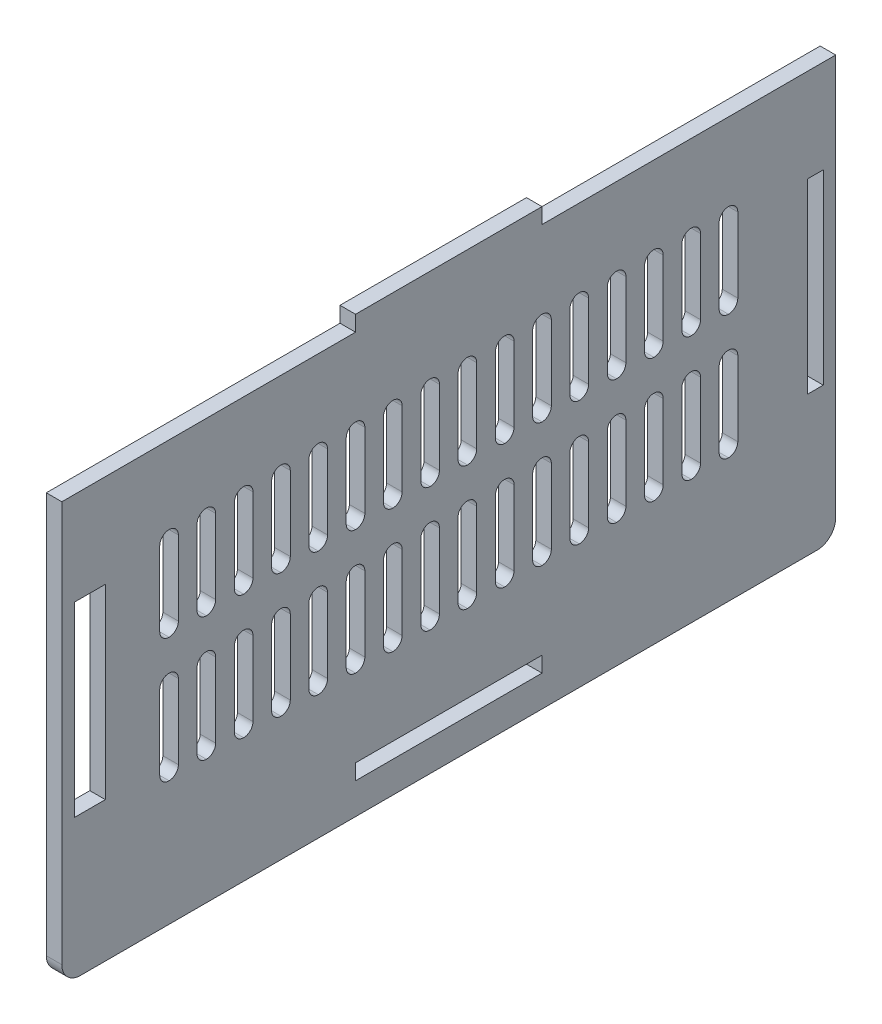
from build123d import *

# Parameters (mm, degrees)
SKETCH1_W           = 2.5
SKETCH1_H           = 30
BOSS_EXTRUDE1_DEPTH = 1.25
FILLET1_R           = 3
SKETCH2_W           = 3
SKETCH2_H           = 15
CUT_EXTRUDE1_DEPTH  = 73.715627619
FILLET2_R           = 1.5


with BuildPart() as part:
    # Sketch1 → Boss-Extrude1 (new, symmetric)
    # profile 1 of 2: a face of its own
    with BuildSketch(Plane(origin=(0, 0, 0), x_dir=(0, 0, -1), z_dir=(1, 0, 0))):
        Polygon((-15, 30), (-62.25, 30), (-62.25, -30), (-15, -30), (15, -30), (62.25, -30), (62.25, 30), (15, 30), (15, 32.5), (-15, 32.5), align=None)
        Polygon((-60.25, 15), (-57.75, 15), (-55.25, 15), (-55.25, -15), (-57.75, -15), (-60.25, -15), align=None, mode=Mode.SUBTRACT)
        with Locations((59, 0)):
            Rectangle(SKETCH1_W, SKETCH1_H, mode=Mode.SUBTRACT)
    # profile 2 of 2: a face of its own
    with BuildSketch(Plane(origin=(0, 0, 0), x_dir=(0, 0, -1), z_dir=(1, 0, 0))):
        Polygon((-15, -30), (-62.25, -30), (-62.25, -37.5), (-15, -37.5), (15, -37.5), (62.25, -37.5), (62.25, -30), (15, -30), (15, -32.5), (-15, -32.5), align=None)
    extrude(amount=BOSS_EXTRUDE1_DEPTH, both=True)

    # Fillet1
    fillet1_edges = [part.edges().sort_by_distance(p)[0] for p in [
        (0, -37.5, 62.25),
        (0, -37.5, -62.25),
    ]]
    fillet(fillet1_edges, radius=FILLET1_R)

    # Sketch2 → Cut-Extrude1 (cut, through all)
    with BuildSketch(Plane(origin=(1.25, 0, 0), x_dir=(0, 0, -1), z_dir=(1, 0, 0))):
        with Locations((-45, 10)):
            Rectangle(SKETCH2_W, SKETCH2_H)
        with Locations((-45, -10)):
            Rectangle(SKETCH2_W, SKETCH2_H)
        with Locations((-39, 10)):
            Rectangle(SKETCH2_W, SKETCH2_H)
        with Locations((-39, -10)):
            Rectangle(SKETCH2_W, SKETCH2_H)
        with Locations((-33, 10)):
            Rectangle(SKETCH2_W, SKETCH2_H)
        with Locations((-33, -10)):
            Rectangle(SKETCH2_W, SKETCH2_H)
        with Locations((-27, 10)):
            Rectangle(SKETCH2_W, SKETCH2_H)
        with Locations((-27, -10)):
            Rectangle(SKETCH2_W, SKETCH2_H)
        with Locations((-21, 10)):
            Rectangle(SKETCH2_W, SKETCH2_H)
        with Locations((-21, -10)):
            Rectangle(SKETCH2_W, SKETCH2_H)
        with Locations((-15, 10)):
            Rectangle(SKETCH2_W, SKETCH2_H)
        with Locations((-15, -10)):
            Rectangle(SKETCH2_W, SKETCH2_H)
        with Locations((-9, 10)):
            Rectangle(SKETCH2_W, SKETCH2_H)
        with Locations((-9, -10)):
            Rectangle(SKETCH2_W, SKETCH2_H)
        with Locations((-3, 10)):
            Rectangle(SKETCH2_W, SKETCH2_H)
        with Locations((-3, -10)):
            Rectangle(SKETCH2_W, SKETCH2_H)
        with Locations((3, -10)):
            Rectangle(SKETCH2_W, SKETCH2_H)
        with Locations((3, 10)):
            Rectangle(SKETCH2_W, SKETCH2_H)
        with Locations((9, -10)):
            Rectangle(SKETCH2_W, SKETCH2_H)
        with Locations((9, 10)):
            Rectangle(SKETCH2_W, SKETCH2_H)
        with Locations((15, -10)):
            Rectangle(SKETCH2_W, SKETCH2_H)
        with Locations((15, 10)):
            Rectangle(SKETCH2_W, SKETCH2_H)
        with Locations((21, -10)):
            Rectangle(SKETCH2_W, SKETCH2_H)
        with Locations((21, 10)):
            Rectangle(SKETCH2_W, SKETCH2_H)
        with Locations((27, -10)):
            Rectangle(SKETCH2_W, SKETCH2_H)
        with Locations((27, 10)):
            Rectangle(SKETCH2_W, SKETCH2_H)
        with Locations((33, -10)):
            Rectangle(SKETCH2_W, SKETCH2_H)
        with Locations((33, 10)):
            Rectangle(SKETCH2_W, SKETCH2_H)
        with Locations((39, -10)):
            Rectangle(SKETCH2_W, SKETCH2_H)
        with Locations((39, 10)):
            Rectangle(SKETCH2_W, SKETCH2_H)
        with Locations((45, -10)):
            Rectangle(SKETCH2_W, SKETCH2_H)
        with Locations((45, 10)):
            Rectangle(SKETCH2_W, SKETCH2_H)
    extrude(amount=-CUT_EXTRUDE1_DEPTH, mode=Mode.SUBTRACT)

    # Fillet2
    fillet2_edges = [part.edges().sort_by_distance(p)[0] for p in [
        (0, -17.5, -46.5),
        (0, -2.5, -46.5),
        (0, -2.5, -43.5),
        (0, -17.5, -43.5),
        (0, 17.5, -40.5),
        (0, 17.5, -37.5),
        (0, 2.5, -37.5),
        (0, 2.5, -40.5),
        (0, -17.5, -40.5),
        (0, -2.5, -40.5),
        (0, -2.5, -37.5),
        (0, -17.5, -37.5),
        (0, 17.5, -34.5),
        (0, 17.5, -31.5),
        (0, 2.5, -31.5),
        (0, 2.5, -34.5),
        (0, -17.5, -34.5),
        (0, -2.5, -34.5),
        (0, -2.5, -31.5),
        (0, -17.5, -31.5),
        (0, 17.5, -28.5),
        (0, 17.5, -25.5),
        (0, 2.5, -25.5),
        (0, 2.5, -28.5),
        (0, -17.5, -28.5),
        (0, -2.5, -28.5),
        (0, -2.5, -25.5),
        (0, -17.5, -25.5),
        (0, 17.5, -22.5),
        (0, 17.5, -19.5),
        (0, 2.5, -19.5),
        (0, 2.5, -22.5),
        (0, -17.5, -22.5),
        (0, -2.5, -22.5),
        (0, -2.5, -19.5),
        (0, -17.5, -19.5),
        (0, 17.5, -16.5),
        (0, 17.5, -13.5),
        (0, 2.5, -13.5),
        (0, 2.5, -16.5),
        (0, -17.5, -16.5),
        (0, -2.5, -16.5),
        (0, -2.5, -13.5),
        (0, -17.5, -13.5),
        (0, 17.5, -10.5),
        (0, 17.5, -7.5),
        (0, 2.5, -7.5),
        (0, 2.5, -10.5),
        (0, -17.5, -10.5),
        (0, -2.5, -10.5),
        (0, -2.5, -7.5),
        (0, -17.5, -7.5),
        (0, 17.5, -4.5),
        (0, 17.5, -1.5),
        (0, 2.5, -1.5),
        (0, 2.5, -4.5),
        (0, -17.5, -4.5),
        (0, -2.5, -4.5),
        (0, -2.5, -1.5),
        (0, -17.5, -1.5),
        (0, 17.5, -46.5),
        (0, 17.5, -43.5),
        (0, 2.5, -43.5),
        (0, 2.5, -46.5),
        (0, -17.5, 4.5),
        (0, -17.5, 1.5),
        (0, -2.5, 1.5),
        (0, -2.5, 4.5),
        (0, 2.5, 1.5),
        (0, 17.5, 1.5),
        (0, 17.5, 4.5),
        (0, 2.5, 4.5),
        (0, -17.5, 10.5),
        (0, -17.5, 7.5),
        (0, -2.5, 7.5),
        (0, -2.5, 10.5),
        (0, 2.5, 7.5),
        (0, 17.5, 7.5),
        (0, 17.5, 10.5),
        (0, 2.5, 10.5),
        (0, -17.5, 16.5),
        (0, -17.5, 13.5),
        (0, -2.5, 13.5),
        (0, -2.5, 16.5),
        (0, 2.5, 13.5),
        (0, 17.5, 13.5),
        (0, 17.5, 16.5),
        (0, 2.5, 16.5),
        (0, -17.5, 22.5),
        (0, -17.5, 19.5),
        (0, -2.5, 19.5),
        (0, -2.5, 22.5),
        (0, 2.5, 19.5),
        (0, 17.5, 19.5),
        (0, 17.5, 22.5),
        (0, 2.5, 22.5),
        (0, -17.5, 28.5),
        (0, -17.5, 25.5),
        (0, -2.5, 25.5),
        (0, -2.5, 28.5),
        (0, 2.5, 25.5),
        (0, 17.5, 25.5),
        (0, 17.5, 28.5),
        (0, 2.5, 28.5),
        (0, -17.5, 34.5),
        (0, -17.5, 31.5),
        (0, -2.5, 31.5),
        (0, -2.5, 34.5),
        (0, 2.5, 31.5),
        (0, 17.5, 31.5),
        (0, 17.5, 34.5),
        (0, 2.5, 34.5),
        (0, -17.5, 40.5),
        (0, -17.5, 37.5),
        (0, -2.5, 37.5),
        (0, -2.5, 40.5),
        (0, 2.5, 37.5),
        (0, 17.5, 37.5),
        (0, 17.5, 40.5),
        (0, 2.5, 40.5),
        (0, -17.5, 46.5),
        (0, -17.5, 43.5),
        (0, -2.5, 43.5),
        (0, -2.5, 46.5),
        (0, 17.5, 43.5),
        (0, 2.5, 46.5),
        (0, 2.5, 43.5),
        (0, 17.5, 46.5),
    ]]
    fillet(fillet2_edges, radius=FILLET2_R - 0.0001)  # a hair under: the kernel refuses the full size


solid = part.part
